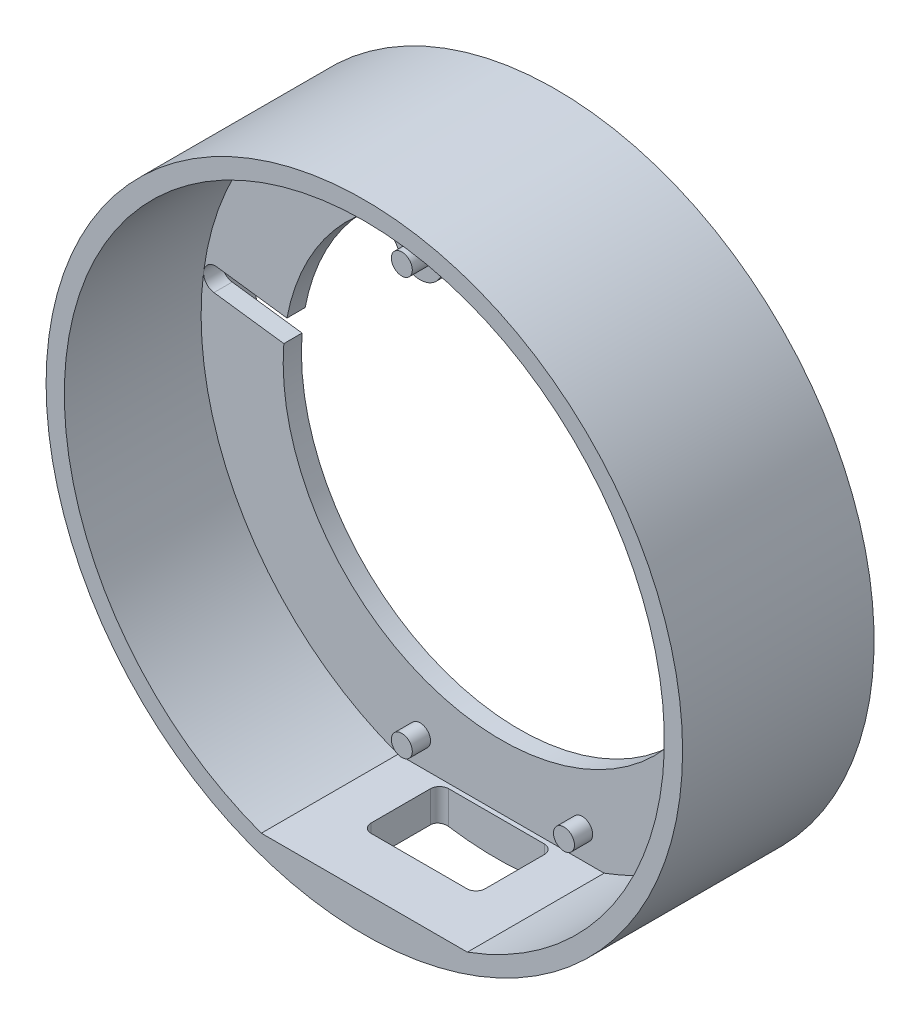
from build123d import *

# Parameters (mm, degrees)
ESQUISSE_SUPPORT_R      = 34.9
BOSS_EXTRU_1_DEPTH      = 2
ESQUISSE6_R             = 1.15
BOSS_EXTRU_2_DEPTH      = 2
BOSS_EXTRU_3_START      = 4
ESQUISSE7_R             = 34.9
ESQUISSE7_R_2           = 32.9
BOSS_EXTRU_3_DEPTH      = 4
ESQUISSE8_R             = 34.9
BOSS_EXTRU_5_DEPTH      = 15
ENL_V_MAT_EXTRU_1_DEPTH = 10


with BuildPart() as part:
    # Esquisse_support → Boss.-Extru.1 (new body)
    with BuildSketch(Plane.XY):
        Circle(ESQUISSE_SUPPORT_R)
        with BuildLine():
            ThreePointArc((-32.616288481, 4.311348477), (-32.115452705, 5.177776046), (-31.148651523, 5.436288481))
            Line((-31.148651523, 5.436288481), (-23.487064643, 4.423549986))
            ThreePointArc((-23.487064643, 4.423549986), (-20.799295594, 11.772820511), (-15.881763126, 17.86))
            ThreePointArc((-15.881763126, 17.86), (-13.316845537, 18.611032405), (-11.220011679, 16.953884347))
            ThreePointArc((-11.220011679, 16.953884347), (-7.983884347, 15.529988321), (-6.559988321, 18.766115653))
            ThreePointArc((-6.559988321, 18.766115653), (-6.450497051, 21.686422251), (-4.183806862, 23.530953235))
            ThreePointArc((-4.183806862, 23.530953235), (0, 23.9), (4.183806862, 23.530953235))
            ThreePointArc((4.183806862, 23.530953235), (6.450497051, 21.686422251), (6.559988321, 18.766115653))
            ThreePointArc((6.559988321, 18.766115653), (7.983884347, 15.529988321), (11.220011679, 16.953884347))
            Line((11.220011679, 16.953884347), (13.517895322, 19.709807357))
            Line((13.517895322, 19.709807357), (18.243699169, 25.871764581))
            ThreePointArc((18.243699169, 25.871764581), (19.084157828, 26.35728211), (20.021764581, 26.106300831))
            ThreePointArc((20.021764581, 26.106300831), (20.50728211, 25.265842172), (20.256300831, 24.328235419))
            Line((20.256300831, 24.328235419), (15.530496983, 18.166278195))
            ThreePointArc((15.530496983, 18.166278195), (23.692512492, 3.142427693), (19.729143793, -13.489658454))
            Line((19.729143793, -13.489658454), (25.863736665, -18.195211742))
            ThreePointArc((25.863736665, -18.195211742), (26.362962372, -19.059550784), (26.104788258, -20.023736665))
            ThreePointArc((26.104788258, -20.023736665), (25.240449216, -20.522962372), (24.276263335, -20.264788258))
            Line((24.276263335, -20.264788258), (18.141670463, -15.559234969))
            ThreePointArc((18.141670463, -15.559234969), (-9.148411266, -22.079777429), (-23.829761597, 1.830973023))
            Line((-23.829761597, 1.830973023), (-31.491348477, 2.843711519))
            ThreePointArc((-31.491348477, 2.843711519), (-32.357776046, 3.344547295), (-32.616288481, 4.311348477))
        make_face(mode=Mode.SUBTRACT)
    extrude(amount=BOSS_EXTRU_1_DEPTH)

    # Esquisse6 → Boss.-Extru.2 (add)
    with BuildSketch(Plane.XY.offset(2)):
        with Locations((-8.89, 17.86)):
            Circle(ESQUISSE6_R)
        with Locations((-8.89, -27.86)):
            Circle(ESQUISSE6_R)
        with Locations((8.89, -27.86)):
            Circle(ESQUISSE6_R)
        with Locations((8.89, 17.86)):
            Circle(ESQUISSE6_R)
    extrude(amount=BOSS_EXTRU_2_DEPTH)

    # Esquisse7 → Boss.-Extru.3 (add)
    with BuildSketch(Plane(origin=(0, 0, 0), x_dir=(-1, 0, 0), z_dir=(0, 0, -1)).offset(BOSS_EXTRU_3_START)):
        Circle(ESQUISSE7_R)
        Circle(ESQUISSE7_R_2, mode=Mode.SUBTRACT)
    extrude(amount=-BOSS_EXTRU_3_DEPTH)

    # Esquisse8 → Boss.-Extru.5 (add)
    with BuildSketch(Plane.XY.offset(2)):
        Circle(ESQUISSE8_R)
        with BuildLine():
            Line((11.296016997, -30.9), (-11.296016997, -30.9))
            ThreePointArc((-11.296016997, -30.9), (0, 32.9), (11.296016997, -30.9))
        make_face(mode=Mode.SUBTRACT)
    extrude(amount=BOSS_EXTRU_5_DEPTH)

    # Ouverture_USB → Enlèv. mat.-Extru.1 (cut)
    with BuildSketch(Plane(origin=(0, -30.9, 0), x_dir=(1, 0, 0), z_dir=(0, 1, 0))):
        with BuildLine():
            Line((-5.25, -11), (5.25, -11))
            ThreePointArc((5.25, -11), (5.957106781, -10.707106781), (6.25, -10))
            Line((6.25, -10), (6.25, -3.5))
            ThreePointArc((6.25, -3.5), (5.957106781, -2.792893219), (5.25, -2.5))
            Line((5.25, -2.5), (-5.25, -2.5))
            ThreePointArc((-5.25, -2.5), (-5.957106781, -2.792893219), (-6.25, -3.5))
            Line((-6.25, -3.5), (-6.25, -10))
            ThreePointArc((-6.25, -10), (-5.957106781, -10.707106781), (-5.25, -11))
        make_face()
    extrude(amount=-ENL_V_MAT_EXTRU_1_DEPTH, mode=Mode.SUBTRACT)


solid = part.part
